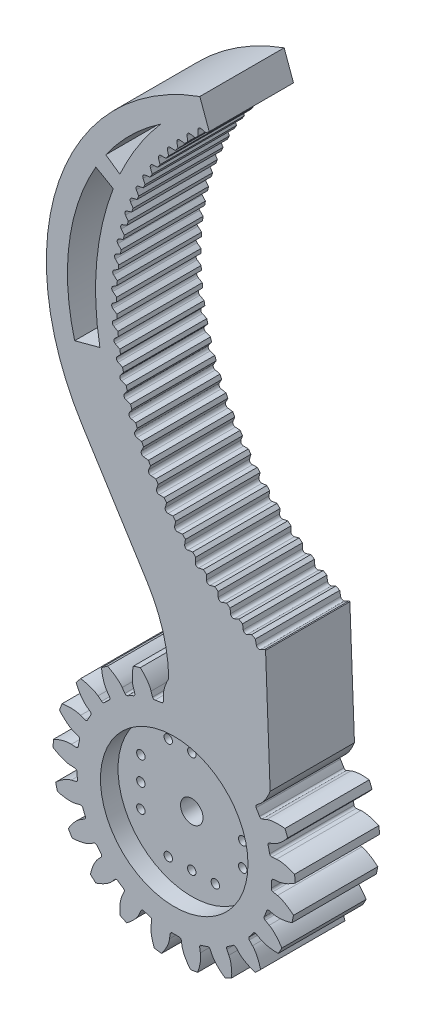
from build123d import *

# Parameters (mm, degrees)
SKETCH_1_R                       = 13.875
EXTRUDE_1_DEPTH                  = 6
EXTRUDE_2_DEPTH                  = 6
EXTRUDE_3_DEPTH                  = 6
FILLET_1_R                       = 0.3
PATTERN_CIRCULAR_1_COUNT         = 21
FILLET_1_OF_PATTERN_CIRCULAR_1_R = 0.3
SKETCH_4_R                       = 10.5
CUT_EXTRUDE_1_DEPTH              = 2.5
SKETCH_5_R                       = 0.6
CUT_EXTRUDE_2_DEPTH              = 5
SKETCH_6_R                       = 1.6
CUT_EXTRUDE_3_DEPTH              = 27.174743343
SKETCH_7_R                       = 5.125
CUT_EXTRUDE_4_DEPTH              = 4.5
EXTRUDE_4_DEPTH                  = 6
FILLET_2_R                       = 20
CUT_EXTRUDE_5_DEPTH              = 6
FILLET_3_R                       = 0.4
PATTERN_CIRCULAR_2_COUNT         = 35
PATTERN_CIRCULAR_2_ANGLE         = 114
FILLET_3_OF_PATTERN_CIRCULAR_2_R = 0.4


with BuildPart() as part:
    # Эскиз1 → Бобышка-Вытянуть1 (new, symmetric)
    with BuildSketch(Plane.XY):
        Circle(SKETCH_1_R)
    extrude(amount=EXTRUDE_1_DEPTH, both=True)

    # Эскиз2 → Бобышка-Вытянуть2 (add, symmetric)
    with BuildSketch(Plane.XY):
        with BuildLine():
            Line((13.819217532, 1.242920673), (14.74065684, 1.325796274))
            ThreePointArc((14.74065684, 1.325796274), (14.666391605, 1.985360704), (14.562629466, 2.640932197))
            Line((14.562629466, 2.640932197), (13.637221041, 2.557699607))
            ThreePointArc((13.637221041, 2.557699607), (13.743950149, 1.902487663), (13.819217532, 1.242920673))
        make_face()
        with BuildLine():
            ThreePointArc((14.800158777, 0), (14.78527581, 0.663565415), (14.74065684, 1.325796274))
            Line((14.74065684, 1.325796274), (13.819217532, 1.242920673))
            ThreePointArc((13.819217532, 1.242920673), (13.861047368, 0.622085903), (13.875, 0))
            ThreePointArc((13.875, 0), (13.874937588, -0.041616482), (13.874750352, -0.08323259))
            Line((13.874750352, -0.08323259), (14.800158777, 0))
        make_face()
    extrude_2 = extrude(amount=EXTRUDE_2_DEPTH, both=True)

    # Эскиз3 → Бобышка-Вытянуть3 (add, symmetric)
    with BuildSketch(Plane.XY):
        with BuildLine():
            add(Edge.make_bspline(
                [(14.800158777, 0), (14.845776289, 0.001981363), (14.973198786, 0.013582419), (15.21326733, 0.059842377), (15.595122693, 0.168724293), (16.073745643, 0.358353676), (16.552069761, 0.59982238), (16.911622458, 0.816083029), (17.134073051, 0.962840807), (17.219740309, 1.021295097)],
                knots=[0, 0, 0, 0, 0, 0.005604071, 0.015718253, 0.029959921, 0.048733673, 0.068727069, 0.081467172, 0.081467172, 0.081467172, 0.081467172, 0.081467172], degree=4))
            ThreePointArc((17.219740309, 1.021295097), (17.180648824, 1.545252728), (17.125618214, 2.067776771))
            add(Edge.make_bspline(
                [(14.562629466, 2.640932197), (14.607868411, 2.647122596), (14.735315977, 2.658444927), (14.979786237, 2.655765099), (15.374941992, 2.616768701), (15.879720834, 2.515587917), (16.393455822, 2.363346462), (16.78582745, 2.214714988), (17.030895288, 2.110006503), (17.125618214, 2.067776771)],
                knots=[0, 0, 0, 0, 0, 0.005604071, 0.015718253, 0.029959921, 0.048733673, 0.068727069, 0.081467172, 0.081467172, 0.081467172, 0.081467172, 0.081467172], degree=4))
            ThreePointArc((14.562629466, 2.640932197), (14.74065684, 1.325796274), (14.800158777, 0))
        make_face()
    extrude_3 = extrude(amount=EXTRUDE_3_DEPTH, both=True)

    # Скругление1
    fillet_1_edges = [part.edges().sort_by_distance(p)[0] for p in [
        (13.637221041, 2.557699607, 0),
        (13.874750352, -0.08323259, 0),
    ]]
    fillet(fillet_1_edges, radius=FILLET_1_R)

    # Круговой массив1: Бобышка-Вытянуть2, Бобышка-Вытянуть3 ×21 about axis
    pattern_circular_1_axis = Axis((0, 0, 6), (0, 0, 1))
    add([extrude_2.rotate(pattern_circular_1_axis, i * 360 / PATTERN_CIRCULAR_1_COUNT) for i in range(1, PATTERN_CIRCULAR_1_COUNT)])
    add([extrude_3.rotate(pattern_circular_1_axis, i * 360 / PATTERN_CIRCULAR_1_COUNT) for i in range(1, PATTERN_CIRCULAR_1_COUNT)])

    # Скругление1 of Круговой массив1
    fillet_1_of_pattern_circular_1_edges = [part.edges().sort_by_distance(p)[0] for p in [
        (12.27746238, 6.463709656, 0),
        (13.28286736, 4.010119661, 0),
        (9.826797307, 9.795390737, 0),
        (11.510743312, 7.747155181, 0),
        (6.502978169, 12.256708364, 0),
        (8.715839207, 10.795821966, 0),
        (2.601340884, 13.628963666, 0),
        (5.146494539, 12.885232592, 0),
        (-1.531436955, 13.790225736, 0),
        (1.119861247, 13.829733757, 0),
        (-5.5281399, 12.726165732, 0),
        (-3.006276632, 13.545402387, 0),
        (-9.033643355, 10.531330055, 0),
        (-6.865293639, 12.057502571, 0),
        (-11.736467955, 7.400739487, 0),
        (-10.114299178, 9.498240739, 0),
        (-13.396455872, 3.612560737, 0),
        (-12.46460485, 6.095018534, 0),
        (-13.866109895, -0.496609887, 0),
        (-13.707375681, 2.150227186, 0),
        (-13.103699204, -4.561654544, 0),
        (-13.732186028, -1.985621285, 0),
        (-11.176967334, -8.221376176, 0),
        (-12.536831384, -5.94503859, 0),
        (-8.257112867, -11.150592455, 0),
        (-10.227524255, -9.376213127, 0),
        (-4.603577686, -13.089029662, 0),
        (-7.009456713, -11.974269981, 0),
        (-0.540994425, -13.864449143, 0),
        (-3.168568182, -13.508360399, 0),
        (3.569658565, -13.407951474, 0),
        (0.953861538, -13.842173715, 0),
        (7.363131726, -11.760098477, 0),
        (4.991536474, -12.946049151, 0),
        (10.50235832, -9.067309122, 0),
        (8.585691489, -10.899611308, 0),
        (12.708404289, -5.56884956, 0),
        (11.416970138, -7.884695167, 0),
        (13.785252767, -1.575573277, 0),
        (13.233800887, -4.169189259, 0),
    ]]
    fillet(fillet_1_of_pattern_circular_1_edges, radius=FILLET_1_OF_PATTERN_CIRCULAR_1_R)

    # Эскиз4 → Вырез-Вытянуть1 (cut)
    with BuildSketch(Plane.XY.offset(6)):
        Circle(SKETCH_4_R)
    extrude(amount=-CUT_EXTRUDE_1_DEPTH, mode=Mode.SUBTRACT)

    # Эскиз5 → Вырез-Вытянуть2 (cut)
    with BuildSketch(Plane.XY.offset(3.5)):
        with Locations((0, 7.25)):
            Circle(SKETCH_5_R)
        with Locations((-3.35, 7.25)):
            Circle(SKETCH_5_R)
        with Locations((3.35, 7.25)):
            Circle(SKETCH_5_R)
        with Locations((-7.25, 0)):
            Circle(SKETCH_5_R)
        with Locations((0, -7.25)):
            Circle(SKETCH_5_R)
        with Locations((7.25, 0)):
            Circle(SKETCH_5_R)
        with Locations((7.25, 3.35)):
            Circle(SKETCH_5_R)
        with Locations((7.25, -3.35)):
            Circle(SKETCH_5_R)
        with Locations((3.35, -7.25)):
            Circle(SKETCH_5_R)
        with Locations((-3.35, -7.25)):
            Circle(SKETCH_5_R)
        with Locations((-7.25, -3.35)):
            Circle(SKETCH_5_R)
        with Locations((-7.25, 3.35)):
            Circle(SKETCH_5_R)
    extrude(amount=-CUT_EXTRUDE_2_DEPTH, mode=Mode.SUBTRACT)

    # Эскиз6 → Вырез-Вытянуть3 (cut, through all)
    with BuildSketch(Plane.XY.offset(3.5)):
        Circle(SKETCH_6_R)
    extrude(amount=-CUT_EXTRUDE_3_DEPTH, mode=Mode.SUBTRACT)

    # Эскиз7 → Вырез-Вытянуть4 (cut)
    with BuildSketch(Plane(origin=(0, 0, -6), x_dir=(-1, 0, 0), z_dir=(0, 0, -1))):
        Circle(SKETCH_7_R)
    extrude(amount=-CUT_EXTRUDE_4_DEPTH, mode=Mode.SUBTRACT)

    # Эскиз8 → Бобышка-Вытянуть4 (add, symmetric)
    with BuildSketch(Plane.XY):
        with BuildLine():
            Line((3.644931242, 91.19779501), (4.978138142, 87.534839156))
            ThreePointArc((4.978138142, 87.534839156), (-7.887494186, 55.3096126), (13, 27.602171209))
            Line((13, 27.602171209), (13.652301114, 10.54405872))
            Line((13.652301114, 10.54405872), (9.269458344, 7.620836044))
            ThreePointArc((9.269458344, 7.620836044), (5.044936552, 10.888003269), (-0.178796796, 11.998667914))
            Line((-0.178796796, 11.998667914), (-0.782195796, 17.232256664))
            Line((-0.782195796, 17.232256664), (-0.327794125, 21.997557842))
            Line((-0.327794125, 21.997557842), (-13.10898745, 42.332945222))
            ThreePointArc((-13.10898745, 42.332945222), (-16.405354946, 70.767714739), (3.644931242, 91.19779501))
        make_face()
        with BuildLine():
            Line((-9.738391738, 77.322008378), (-7.73905741, 75.922059411))
            ThreePointArc((-7.73905741, 75.922059411), (-5.151046872, 80.674318523), (-1.92, 85.015067459))
            ThreePointArc((-1.92, 85.015067459), (-6.181387822, 81.526467661), (-9.738391738, 77.322008378))
        make_face(mode=Mode.SUBTRACT)
        with BuildLine():
            Line((-8.680520659, 73.671954977), (-11.153967194, 75.1))
            ThreePointArc((-11.153967194, 75.1), (-14.941634813, 63.941891005), (-14.170959954, 52.183664838))
            Line((-14.170959954, 52.183664838), (-10.582486211, 53.145193479))
            ThreePointArc((-10.582486211, 53.145193479), (-11.03640394, 63.538749286), (-8.680520659, 73.671954977))
        make_face(mode=Mode.SUBTRACT)
    extrude(amount=EXTRUDE_4_DEPTH, both=True)

    # Скругление2
    # the kernel refuses this fillet: 20 mm, written as the material it adds along each edge
    with BuildSketch(Plane(origin=(-0.327794125, 21.997557842, -6), x_dir=(-0.09492574296847507, -0.9954843561412119, 0), z_dir=(0, 0, 1))) as fillet_2_piece_1:
        with BuildLine():
            CenterArc((6.962080408, -19.881364767), FILLET_2_R, 96.243733939, 31.353486116)
            Line((-5.240054031, -4.034979843), (-5.48409672, -3.718052145))
            Line((-5.48409672, -3.718052145), (-0.244042689, 0.316927698))
            Line((-0.244042689, 0.316927698), (0, 0.4))
            ThreePointArc((0, 0.4), (2.393458596, 0.4), (4.743413927, 0.397627295))
            Line((4.743413927, 0.397627295), (4.786917191, 0))
        make_face()
    extrude(amount=12)

    # Эскиз9 → Вырез-Вытянуть5 (cut, symmetric)
    with BuildSketch(Plane.XY):
        Polygon((11.790812643, 27.051024142), (14.170665278, 28.368712055), (11.27048036, 29.721090493), align=None)
    cut_extrude_5 = extrude(amount=CUT_EXTRUDE_5_DEPTH, both=True, mode=Mode.SUBTRACT)

    # Скругление3
    fillet_3_edges = [part.edges().sort_by_distance(p)[0] for p in [
        (11.790812643, 27.051024142, 0),
    ]]
    fillet(fillet_3_edges, radius=FILLET_3_R)

    # Круговой массив2: Вырез-Вытянуть5 ×35 about axis
    pattern_circular_2_axis = Axis((27.155172414, 60, 0), (0, 0, -1))
    for i in range(1, PATTERN_CIRCULAR_2_COUNT):
        add(cut_extrude_5.rotate(pattern_circular_2_axis, i * PATTERN_CIRCULAR_2_ANGLE / (PATTERN_CIRCULAR_2_COUNT - 1)), mode=Mode.SUBTRACT)

    # Скругление3 of Круговой массив2
    fillet_3_of_pattern_circular_2_edges = [part.edges().sort_by_distance(p)[0] for p in [
        (9.890044112, 28.006033288, 0),
        (8.048384426, 29.070576888, 0),
        (6.272138686, 30.241010374, 0),
        (4.567388041, 31.513326653, 0),
        (2.939968871, 32.883169827, 0),
        (1.395452804, 34.345850104, 0),
        (-0.060872359, 35.896359857, 0),
        (-1.424020748, 37.529390764, 0),
        (-2.689325492, 39.239351986, 0),
        (-3.852454697, 41.020389304, 0),
        (-4.909426277, 42.866405163, 0),
        (-5.856621587, 44.77107955, 0),
        (-6.690797812, 46.727891626, 0),
        (-7.409099069, 48.730142055, 0),
        (-8.009066183, 50.770975938, 0),
        (-8.488645109, 52.843406282, 0),
        (-8.846193961, 54.940337919, 0),
        (-9.080488637, 57.054591802, 0),
        (-9.190727005, 59.178929576, 0),
        (-9.176531655, 61.306078364, 0),
        (-9.037951185, 63.428755666, 0),
        (-8.775460038, 65.53969429, 0),
        (-8.38995688, 67.631667232, 0),
        (-7.882761517, 69.697512419, 0),
        (-7.255610382, 71.73015723, 0),
        (-6.510650587, 73.722642708, 0),
        (-5.650432576, 75.668147385, 0),
        (-4.677901388, 77.560010637, 0),
        (-3.596386578, 79.391755486, 0),
        (-2.409590817, 81.157110775, 0),
        (-1.121577216, 82.850032639, 0),
        (0.263244586, 84.464725196, 0),
        (1.740133516, 85.995660389, 0),
        (3.304033301, 87.437596911, 0),
    ]]
    fillet(fillet_3_of_pattern_circular_2_edges, radius=FILLET_3_OF_PATTERN_CIRCULAR_2_R)


solid = part.part
